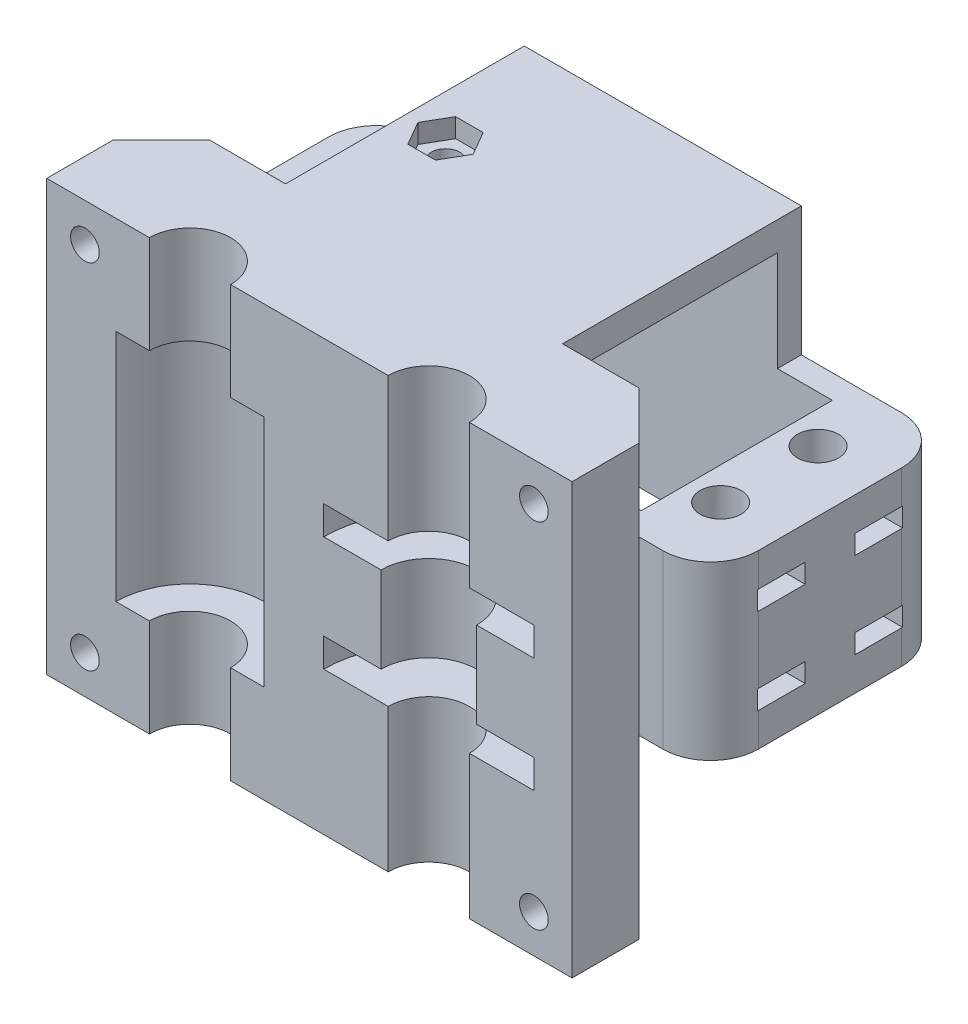
from build123d import *

# Parameters (mm, degrees)
ESQUISSE1_W                  = 55
ESQUISSE1_H                  = 45
BOSS_EXTRU_1_DEPTH           = 12
ESQUISSE2_R                  = 4.25
ENL_V_MAT_EXTRU_1_DEPTH      = 55.085580333
ENL_V_MAT_EXTRU_2_DEPTH      = 12.25
ENL_V_MAT_EXTRU_2_DEPTH_BACK = 12.25
ESQUISSE3_R                  = 7.75
ESQUISSE4_R                  = 11
ENL_V_MAT_EXTRU_3_DEPTH      = 3
ESQUISSE5_R                  = 5
ENL_V_MAT_EXTRU_4_DEPTH      = 15
ENL_V_MAT_EXTRU_5_DEPTH      = 38.503333185
ENL_V_MAT_EXTRU_5_DEPTH_BACK = 38.503333185
ESQUISSE6_R                  = 1.5
ESQUISSE7_R                  = 2.5
ENL_V_MAT_EXTRU_6_DEPTH      = 4
CHANFREIN3_SIZE              = 5
ESQUISSE9_W                  = 60
ESQUISSE9_H                  = 18
BOSS_EXTRU_2_DEPTH           = 25
ESQUISSE10_W                 = 40.5
ESQUISSE10_H                 = 20
ENL_V_MAT_EXTRU_7_DEPTH      = 30
ESQUISSE11_R                 = 2.15
ENL_V_MAT_EXTRU_8_DEPTH      = 51.17220346
CONG_2_R                     = 5
CONG_3_R                     = 5
ESQUISSE12_W                 = 5
ESQUISSE12_H                 = 2
ENL_V_MAT_EXTRU_9_DEPTH      = 9
SYM_TRIE4_COPY_1_SKETCH_W    = 5
SYM_TRIE4_COPY_1_SKETCH_H    = 2
SYM_TRIE4_COPY_1_DEPTH       = 9
ESQUISSE13_W                 = 29
ESQUISSE13_H                 = 3
BOSS_EXTRU_3_DEPTH           = 25
BOSS_EXTRU_4_REACH           = 52.172
ESQUISSE14_W                 = 29
ESQUISSE14_H                 = 2.5
ESQUISSE15_R                 = 1.5
ENL_V_MAT_EXTRU_10_DEPTH     = 9
ENL_V_MAT_EXTRU_11_DEPTH     = 2


with BuildPart() as part:
    # Esquisse1 → Boss.-Extru.1 (new body)
    with BuildSketch(Plane.XY):
        Rectangle(ESQUISSE1_W, ESQUISSE1_H)
    extrude(amount=BOSS_EXTRU_1_DEPTH)

    # Esquisse2 → Enlèv. mat.-Extru.1 (cut, through all)
    with BuildSketch(Plane(origin=(0, 22.5, 0), x_dir=(1, 0, 0), z_dir=(0, 1, 0))):
        with Locations((-12.5, -12)):
            Circle(ESQUISSE2_R)
        with Locations((12.5, -12)):
            Circle(ESQUISSE2_R)
    extrude(amount=-ENL_V_MAT_EXTRU_1_DEPTH, mode=Mode.SUBTRACT)

    # Esquisse3 → Enlèv. mat.-Extru.2 (cut, two sides: drawn at the far end of the back side and taken through both)
    with BuildSketch(Plane(origin=(0, 0, 0), x_dir=(1, 0, 0), z_dir=(0, 1, 0)).offset(-ENL_V_MAT_EXTRU_2_DEPTH_BACK)):
        with Locations((-12.5, -12)):
            Circle(ESQUISSE3_R)
    extrude(amount=ENL_V_MAT_EXTRU_2_DEPTH + ENL_V_MAT_EXTRU_2_DEPTH_BACK, mode=Mode.SUBTRACT)

    # Esquisse4 → Enlèv. mat.-Extru.3 (cut)
    with BuildSketch(Plane(origin=(0, 7.5, 0), x_dir=(1, 0, 0), z_dir=(0, 1, 0))):
        with Locations((12.5, -12)):
            Circle(ESQUISSE4_R)
    enl_v_mat_extru_3 = extrude(amount=-ENL_V_MAT_EXTRU_3_DEPTH, mode=Mode.SUBTRACT)

    # Esquisse5 → Enlèv. mat.-Extru.4 (cut)
    with BuildSketch(Plane(origin=(0, 7.5, 0), x_dir=(1, 0, 0), z_dir=(0, 1, 0))):
        with Locations((12.5, -12)):
            Circle(ESQUISSE5_R)
    extrude(amount=-ENL_V_MAT_EXTRU_4_DEPTH, mode=Mode.SUBTRACT)

    # Esquisse6 → Enlèv. mat.-Extru.5 (cut, two sides: drawn at the far end of the back side and taken through both)
    with BuildSketch(Plane(origin=(0, 0, 0), x_dir=(-1, 0, 0), z_dir=(0, 0, -1)).offset(-ENL_V_MAT_EXTRU_5_DEPTH_BACK)):
        with Locations((23.5, -18.5)):
            Circle(ESQUISSE6_R)
        with Locations((-23.5, -18.5)):
            Circle(ESQUISSE6_R)
        with Locations((-23.5, 18.5)):
            Circle(ESQUISSE6_R)
        with Locations((23.5, 18.5)):
            Circle(ESQUISSE6_R)
    extrude(amount=ENL_V_MAT_EXTRU_5_DEPTH + ENL_V_MAT_EXTRU_5_DEPTH_BACK, mode=Mode.SUBTRACT)

    # Esquisse7 → Enlèv. mat.-Extru.6 (cut)
    with BuildSketch(Plane(origin=(0, 0, 0), x_dir=(-1, 0, 0), z_dir=(0, 0, -1))):
        with Locations((23.5, -18.5)):
            Circle(ESQUISSE7_R)
        with Locations(Location((23.5, 18.5, 0), (0, 0, 180))):
            Circle(ESQUISSE7_R)
        with Locations((-23.5, 18.5)):
            Circle(ESQUISSE7_R)
        with Locations(Location((-23.5, -18.5, 0), (0, 0, 180))):
            Circle(ESQUISSE7_R)
    extrude(amount=-ENL_V_MAT_EXTRU_6_DEPTH, mode=Mode.SUBTRACT)

    # Chanfrein3
    # the kernel refuses this chamfer: 5 mm, written as the material it takes off along each edge
    with BuildSketch(Plane(origin=(-27.5, 35.35841494, 0), x_dir=(0.9996219169112968, 0, -0.027495876610586372), z_dir=(0, -1, 0)), Plane(origin=(27.5, -35.35841494, 0), x_dir=(-0.9996219169112968, 0, -0.027495876610586372), z_dir=(0, 1, 0))) as chanfrein3_piece_1:
        Polygon((CHANFREIN3_SIZE * 0.999621916911, CHANFREIN3_SIZE * 0.0274958766106), (-CHANFREIN3_SIZE * 0.0274958766106, CHANFREIN3_SIZE * 0.999621916911), (0, 0), align=None)
    extrude(amount=70.71682988, mode=Mode.SUBTRACT)

    # Symétrie2: Enlèv. mat.-Extru.3 across plane
    add(enl_v_mat_extru_3.mirror(Plane.ZX), mode=Mode.SUBTRACT)

    # Esquisse9 → Boss.-Extru.2 (add)
    with BuildSketch(Plane(origin=(0, 0, 0), x_dir=(-1, 0, 0), z_dir=(0, 0, -1))):
        Rectangle(ESQUISSE9_W, ESQUISSE9_H)
    extrude(amount=BOSS_EXTRU_2_DEPTH)

    # Esquisse10 → Enlèv. mat.-Extru.7 (cut)
    with BuildSketch(Plane(origin=(0, 9, 0), x_dir=(1, 0, 0), z_dir=(0, 1, 0))):
        with Locations((0, 12.5)):
            Rectangle(ESQUISSE10_W, ESQUISSE10_H)
    extrude(amount=-ENL_V_MAT_EXTRU_7_DEPTH, mode=Mode.SUBTRACT)

    # Esquisse11 → Enlèv. mat.-Extru.8 (cut, through all)
    with BuildSketch(Plane(origin=(0, -9, 0), x_dir=(-1, 0, 0), z_dir=(0, -1, 0))):
        with Locations(Location((-23.65, 7.4, 0), (0, 0, 90))):
            Circle(ESQUISSE11_R)
        with Locations(Location((-23.65, 17.6, 0), (0, 0, 90))):
            Circle(ESQUISSE11_R)
        with Locations(Location((24.15, 7.4, 0), (0, 0, 90))):
            Circle(ESQUISSE11_R)
        with Locations(Location((24.15, 17.6, 0), (0, 0, 90))):
            Circle(ESQUISSE11_R)
    extrude(amount=-ENL_V_MAT_EXTRU_8_DEPTH, mode=Mode.SUBTRACT)

    # Congé2
    cong_2_edges = [part.edges().sort_by_distance(p)[0] for p in [
        (-30, 0, 0),
        (30, 0, 0),
    ]]
    fillet(cong_2_edges, radius=CONG_2_R)

    # Congé3
    cong_3_edges = [part.edges().sort_by_distance(p)[0] for p in [
        (-30, 0, -25),
        (30, 0, -25),
    ]]
    fillet(cong_3_edges, radius=CONG_3_R)

    # Esquisse12 → Enlèv. mat.-Extru.9 (cut)
    with BuildSketch(Plane(origin=(30, 0, 0), x_dir=(0, 0, -1), z_dir=(1, 0, 0))):
        with Locations((7.4, 4.5)):
            Rectangle(ESQUISSE12_W, ESQUISSE12_H)
        with Locations((17.6, 4.5)):
            Rectangle(ESQUISSE12_W, ESQUISSE12_H)
    enl_v_mat_extru_9 = extrude(amount=-ENL_V_MAT_EXTRU_9_DEPTH, mode=Mode.SUBTRACT)

    # Symétrie3: Enlèv. mat.-Extru.9 across plane
    add(enl_v_mat_extru_9.mirror(Plane(origin=(0, 0, 0), x_dir=(0, 0, 1), z_dir=(1, 0, 0))), mode=Mode.SUBTRACT)

    # Symétrie4: Enlèv. mat.-Extru.9 across plane
    add(enl_v_mat_extru_9.mirror(Plane.ZX), mode=Mode.SUBTRACT)

    # Symétrie4 copy 1 sketch → Symétrie4 copy 1 (cut)
    with BuildSketch(Plane(origin=(-30, 0, 0), x_dir=(0, 0, -1), z_dir=(-1, 0, 0))):
        with Locations((7.4, 4.5)):
            Rectangle(SYM_TRIE4_COPY_1_SKETCH_W, SYM_TRIE4_COPY_1_SKETCH_H)
        with Locations((17.6, 4.5)):
            Rectangle(SYM_TRIE4_COPY_1_SKETCH_W, SYM_TRIE4_COPY_1_SKETCH_H)
    extrude(amount=-SYM_TRIE4_COPY_1_DEPTH, mode=Mode.SUBTRACT)

    # Esquisse13 → Boss.-Extru.3 (add)
    with BuildSketch(Plane(origin=(0, 0, 0), x_dir=(-1, 0, 0), z_dir=(0, 0, -1))):
        with Locations((0, 21)):
            Rectangle(ESQUISSE13_W, ESQUISSE13_H)
    extrude(amount=BOSS_EXTRU_3_DEPTH)

    # Esquisse14 → Boss.-Extru.4 (add, up to next)
    with BuildSketch(Plane(origin=(0, 9, 0), x_dir=(1, 0, 0), z_dir=(0, 1, 0)), mode=Mode.PRIVATE) as boss_extru_4_sk1:
        with Locations((0, 23.75)):
            Rectangle(ESQUISSE14_W, ESQUISSE14_H)
    boss_extru_4_tool1 = extrude(boss_extru_4_sk1.sketch, amount=BOSS_EXTRU_4_REACH, mode=Mode.PRIVATE) - part.part
    add(boss_extru_4_tool1.solids().sort_by_distance((0, 9, -23.75))[0])

    # Esquisse15 → Enlèv. mat.-Extru.10 (cut)
    with BuildSketch(Plane(origin=(0, 22.5, 0), x_dir=(1, 0, 0), z_dir=(0, 1, 0))):
        with Locations(Location((-10.25, 12.5, 0), (0, 0, 270))):
            Circle(ESQUISSE15_R)
    extrude(amount=-ENL_V_MAT_EXTRU_10_DEPTH, mode=Mode.SUBTRACT)

    # Esquisse16 → Enlèv. mat.-Extru.11 (cut)
    with BuildSketch(Plane(origin=(0, 22.5, 0), x_dir=(1, 0, 0), z_dir=(0, 1, 0))):
        Polygon((-8.806624327, 15), (-11.693375673, 15), (-13.136751346, 12.5), (-11.693375673, 10), (-8.806624327, 10), (-7.363248654, 12.5), align=None)
    extrude(amount=-ENL_V_MAT_EXTRU_11_DEPTH, mode=Mode.SUBTRACT)


solid = part.part
